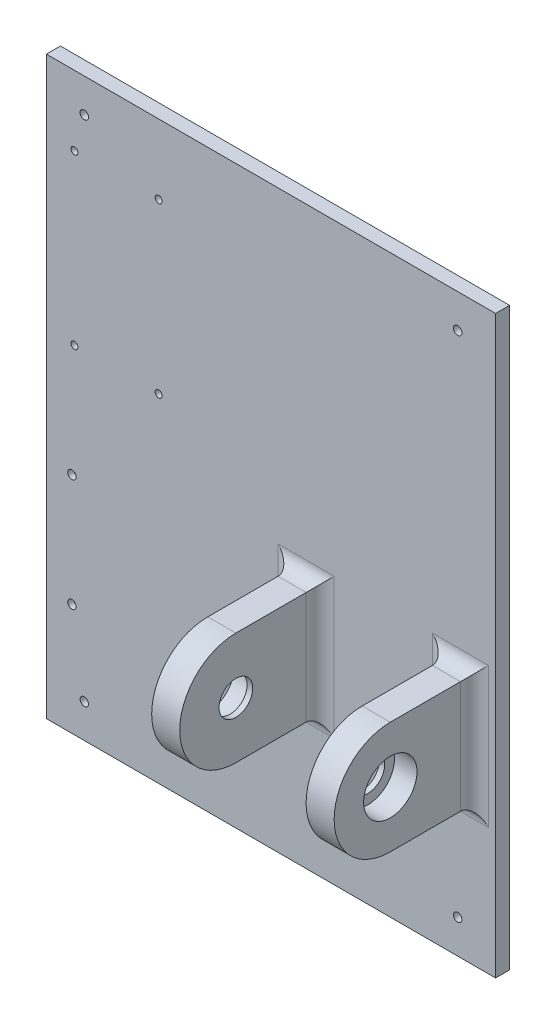
from build123d import *

# Parameters (mm, degrees)
SKETCH_2_W               = 160
SKETCH_2_H               = 205
EXTRUDE_1_DEPTH          = 5
SKETCH_3_W               = 10
SKETCH_3_H               = 40
EXTRUDE_2_DEPTH          = 35
SKETCH_4_R               = 20
EXTRUDE_3_DEPTH          = 10
SKETCH_5_R               = 9.5
CUT_EXTRUDE_1_DEPTH      = 8
SKETCH_13_R              = 6
CUT_EXTRUDE_2_DEPTH      = 168.676290055
FILLET_1_R               = 5
FILLET_1_OF_MIRROR_2_R   = 5
SKETCH_14_R              = 1.5
CUT_EXTRUDE_3_DEPTH      = 10
SKETCH_15_R              = 2.85
CUT_EXTRUDE_4_DEPTH      = 3
CUT_EXTRUDE_5_DEPTH      = 181.233427106
CUT_EXTRUDE_5_DEPTH_BACK = 181.233427106
SKETCH_18_R              = 1.5
M3X0_5_1_D               = 2.5
M3X0_5_2_D               = 2.5


with BuildPart() as part:
    # ｽｹｯﾁ2 → ﾎﾞｽ - 押し出し1 (new body)
    with BuildSketch(Plane.XY):
        with Locations((-40, 22.336245724)):
            Rectangle(SKETCH_2_W, SKETCH_2_H)
    extrude(amount=EXTRUDE_1_DEPTH)

    # ｽｹｯﾁ3 → ﾎﾞｽ - 押し出し2 (add)
    with BuildSketch(Plane.XY):
        with Locations((-27.5, -10)):
            Rectangle(SKETCH_3_W, SKETCH_3_H)
    extrude_2 = extrude(amount=EXTRUDE_2_DEPTH)

    # ｽｹｯﾁ4 → ﾎﾞｽ - 押し出し3 (add)
    with BuildSketch(Plane.ZY.offset(32.5)):
        with Locations((35, -10)):
            Circle(SKETCH_4_R)
    extrude_3 = extrude(amount=-EXTRUDE_3_DEPTH)

    # ｽｹｯﾁ5 → ｶｯﾄ - 押し出し1 (cut)
    with BuildSketch(Plane.ZY.offset(32.5)):
        with Locations((35, -10)):
            Circle(SKETCH_5_R)
    cut_extrude_1 = extrude(amount=-CUT_EXTRUDE_1_DEPTH, mode=Mode.SUBTRACT)

    # ｽｹｯﾁ13 → ｶｯﾄ - 押し出し2 (cut, through all)
    with BuildSketch(Plane(origin=(-22.5, 0, 0), x_dir=(0, 0, -1), z_dir=(1, 0, 0))):
        with Locations((-35, -10)):
            Circle(SKETCH_13_R)
    cut_extrude_2 = extrude(amount=-CUT_EXTRUDE_2_DEPTH, mode=Mode.SUBTRACT)

    # ﾌｨﾚｯﾄ1
    fillet_1_edges = [part.edges().sort_by_distance(p)[0] for p in [
        (-27.5, -30, 5),
        (-32.5, -10, 5),
        (-27.5, 10, 5),
        (-22.5, -10, 5),
    ]]
    fillet(fillet_1_edges, radius=FILLET_1_R)

    # ﾐﾗｰ2: ﾎﾞｽ - 押し出し2, ﾎﾞｽ - 押し出し3, ｶｯﾄ - 押し出し1, ｶｯﾄ - 押し出し2 across plane
    add(extrude_2.mirror(Plane(origin=(0, 0, 0), x_dir=(0, 0, 1), z_dir=(1, 0, 0))))
    add(extrude_3.mirror(Plane(origin=(0, 0, 0), x_dir=(0, 0, 1), z_dir=(1, 0, 0))))
    add(cut_extrude_1.mirror(Plane(origin=(0, 0, 0), x_dir=(0, 0, 1), z_dir=(1, 0, 0))), mode=Mode.SUBTRACT)
    add(cut_extrude_2.mirror(Plane(origin=(0, 0, 0), x_dir=(0, 0, 1), z_dir=(1, 0, 0))), mode=Mode.SUBTRACT)

    # ﾌｨﾚｯﾄ1 of ﾐﾗｰ2
    fillet_1_of_mirror_2_edges = [part.edges().sort_by_distance(p)[0] for p in [
        (27.5, -30, 5),
        (32.5, -10, 5),
        (27.5, 10, 5),
        (22.5, -10, 5),
    ]]
    fillet(fillet_1_of_mirror_2_edges, radius=FILLET_1_OF_MIRROR_2_R)

    # ｽｹｯﾁ14 → ｶｯﾄ - 押し出し3 (cut)
    with BuildSketch(Plane.XY):
        with Locations((-110.9, -0.35)):
            Circle(SKETCH_14_R)
        with Locations((-110.9, -40.35)):
            Circle(SKETCH_14_R)
    extrude(amount=CUT_EXTRUDE_3_DEPTH, mode=Mode.SUBTRACT)

    # ｽｹｯﾁ15 → ｶｯﾄ - 押し出し4 (cut)
    with BuildSketch(Plane.XY):
        with Locations((-110.9, -40.35)):
            Circle(SKETCH_15_R)
        Polygon((-113.75, -1.995448267), (-110.9, -3.640896534), (-108.05, -1.995448267), (-108.05, 1.295448267), (-110.9, 2.940896534), (-113.75, 1.295448267), align=None)
        Polygon((-113.75, -41.995448267), (-110.9, -43.640896534), (-108.05, -41.995448267), (-108.05, -38.704551733), (-110.9, -37.059103466), (-113.75, -38.704551733), align=None)
    extrude(amount=CUT_EXTRUDE_4_DEPTH, mode=Mode.SUBTRACT)

    # ｽｹｯﾁ18 → ｶｯﾄ - 押し出し5 (cut, two sides: drawn at the far end of the back side and taken through both)
    with BuildSketch(Plane.XY.offset(5).offset(-CUT_EXTRUDE_5_DEPTH_BACK)):
        with Locations((-106.5, 112.836245724)):
            Circle(SKETCH_18_R)
        with Locations((-106.5, -68.163754276)):
            Circle(SKETCH_18_R)
        with Locations((26.5, -68.163754276)):
            Circle(SKETCH_18_R)
        with Locations((26.5, 112.836245724)):
            Circle(SKETCH_18_R)
    extrude(amount=CUT_EXTRUDE_5_DEPTH + CUT_EXTRUDE_5_DEPTH_BACK, mode=Mode.SUBTRACT)

    # M3x0.5 ねじ穴1 (through all)
    with Locations(Plane.XY.offset(5)):
        with Locations((-110, 100), (-80, 100)):
            Hole(M3X0_5_1_D / 2)

    # M3x0.5 ねじ穴2 (through all)
    with Locations(Plane.XY.offset(5)):
        with Locations((-80, 40), (-110, 40)):
            Hole(M3X0_5_2_D / 2)


solid = part.part
